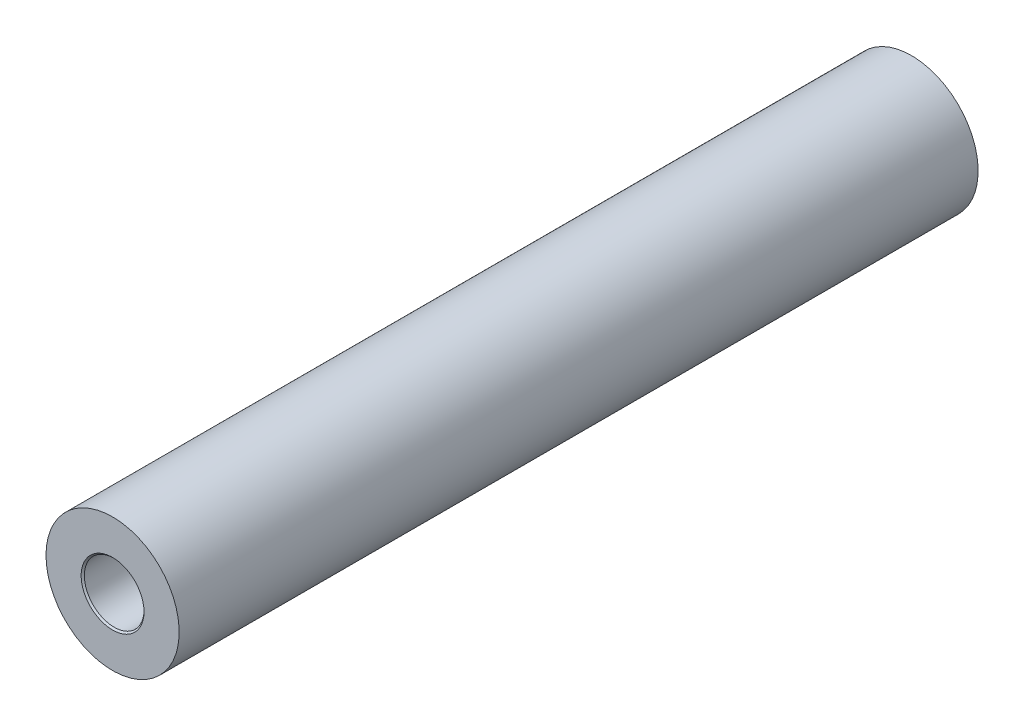
from build123d import *

# Parameters (mm, degrees)
BOSS_EXTRUDE1_START = 19.05
SKETCH13_R          = 1.4224
BOSS_EXTRUDE1_DEPTH = 6.35
CIRPATTERN1_COUNT   = 2
CIRPATTERN1_ANGLE   = 180
EXTRUDE1_DEPTH      = 19.05
EXTRUDE1_DEPTH_BACK = 19.05
SKETCH1_R           = 3.175


# Read off the part's stored shape, not the designer's step: Boss-Extrude2
with BuildPart() as part:
    # Sketch13 → Boss-Extrude1 (new body)
    with BuildSketch(Plane.XY.offset(BOSS_EXTRUDE1_START)):
        Circle(SKETCH13_R)
    extrude(amount=-BOSS_EXTRUDE1_DEPTH)

    # Boss-Extrude2 outline → Boss-Extrude2 (revolve)
    with BuildSketch(Plane.XZ):
        Polygon((1.4224, 19.05), (1.4224, 18.9738), (1.4986, 19.05), align=None)
    revolve(axis=Axis((0, 0, 0), (0, 0, 1)))


with BuildPart() as cirpattern1_1:
    # CirPattern1: pattern copy
    add(part.part.rotate(Axis((0, 3.175, 0), (0, -1, 0)), 1 * CIRPATTERN1_ANGLE / (CIRPATTERN1_COUNT - 1)))


with BuildPart() as body_3:
    # Sketch1 → Extrude1 (new, two sides: drawn at the far end of the back side and taken through both)
    with BuildSketch(Plane.XY.offset(-EXTRUDE1_DEPTH_BACK)):
        with Locations(Location((0, 0, 0), (0, 0, 180))):
            Circle(SKETCH1_R)
    extrude(amount=EXTRUDE1_DEPTH + EXTRUDE1_DEPTH_BACK)

    # Combine1: cut CirPattern1_1, part
    add(cirpattern1_1.part, mode=Mode.SUBTRACT)
    add(part.part, mode=Mode.SUBTRACT)


solid = body_3.part
